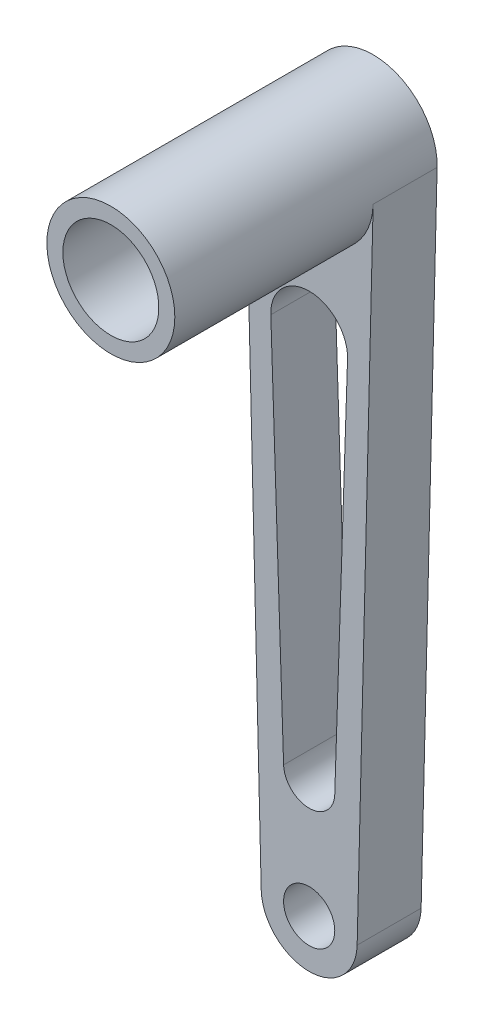
from build123d import *

# Parameters (mm, degrees)
SKETCH1_R           = 4
BOSS_EXTRUDE2_DEPTH = 10
SKETCH1_6_R         = 7.5
BOSS_EXTRUDE3_DEPTH = 41


with BuildPart() as part:
    # Sketch1 → Boss-Extrude2 (new body)
    with BuildSketch(Plane.XY):
        with BuildLine():
            ThreePointArc((9.996972197, -0.246062766), (5.5e-08, -10), (-9.996972195, -0.246062876))
            Line((-9.996972195, -0.246062876), (-7.497729139, -101.784547426))
            ThreePointArc((-7.497729139, -101.784547426), (1.58e-07, -109.1), (7.497729147, -101.784547111))
            Line((7.497729147, -101.784547111), (9.996972197, -0.246062766))
        make_face()
        with BuildLine():
            Line((5.996665744, -23.199999888), (3.997777167, -83.133333141))
            ThreePointArc((3.997777167, -83.133333141), (1.93e-07, -87), (-3.997777154, -83.133333527))
            Line((-3.997777154, -83.133333527), (-5.996665745, -23.199999845))
            ThreePointArc((-5.996665745, -23.199999845), (2.1e-08, -17), (5.996665744, -23.199999888))
        make_face(mode=Mode.SUBTRACT)
        with Locations((0, -101.6)):
            Circle(SKETCH1_R, mode=Mode.SUBTRACT)
    extrude(amount=BOSS_EXTRUDE2_DEPTH)

    # Sketch1<6> → Boss-Extrude3 (add)
    with BuildSketch(Plane.XY):
        with BuildLine():
            ThreePointArc((10, 0), (-0.123040752, 9.99924302), (-9.996972195, -0.246062876))
            ThreePointArc((-9.996972195, -0.246062876), (5.5e-08, -10), (9.996972197, -0.246062766))
            ThreePointArc((9.996972197, -0.246062766), (9.999243021, -0.123040697), (10, 0))
        make_face()
        Circle(SKETCH1_6_R, mode=Mode.SUBTRACT)
    extrude(amount=BOSS_EXTRUDE3_DEPTH)


solid = part.part
